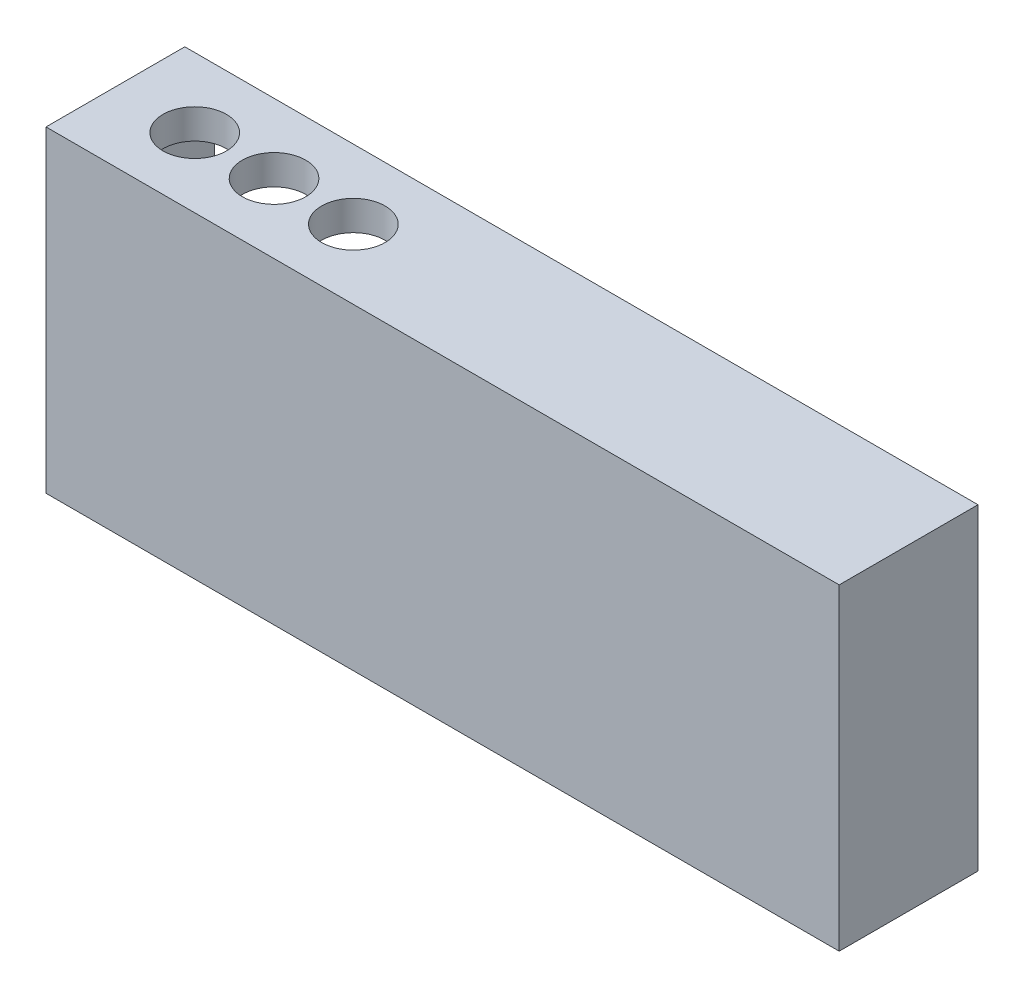
from build123d import *

# Parameters (mm, degrees)
CROQUIS1_W              = 200
CROQUIS1_H              = 80
SALIENTE_EXTRUIR1_DEPTH = 35
CROQUIS2_W              = 185
CROQUIS2_H              = 65
CORTAR_EXTRUIR1_DEPTH   = 27.5
CROQUIS3_R              = 8
CORTAR_EXTRUIR2_DEPTH   = 7.5
CROQUIS4_R              = 5.4
CORTAR_EXTRUIR3_DEPTH   = 7.5
CROQUIS5_R              = 2.50919292
CORTAR_EXTRUIR4_DEPTH   = 2


with BuildPart() as part:
    # Croquis1 → Saliente-Extruir1 (new body)
    with BuildSketch(Plane.XY):
        Rectangle(CROQUIS1_W, CROQUIS1_H)
    extrude(amount=SALIENTE_EXTRUIR1_DEPTH)

    # Croquis2 → Cortar-Extruir1 (cut)
    with BuildSketch(Plane(origin=(0, 0, 0), x_dir=(-1, 0, 0), z_dir=(0, 0, -1))):
        Rectangle(CROQUIS2_W, CROQUIS2_H)
    extrude(amount=-CORTAR_EXTRUIR1_DEPTH, mode=Mode.SUBTRACT)

    # Croquis3 → Cortar-Extruir2 (cut)
    with BuildSketch(Plane(origin=(0, 40, 0), x_dir=(1, 0, 0), z_dir=(0, 1, 0))):
        with Locations((-80, -17.5)):
            Circle(CROQUIS3_R)
        with Locations((-60, -17.5)):
            Circle(CROQUIS3_R)
        with Locations((-40, -17.5)):
            Circle(CROQUIS3_R)
    extrude(amount=-CORTAR_EXTRUIR2_DEPTH, mode=Mode.SUBTRACT)

    # Croquis4 → Cortar-Extruir3 (cut)
    with BuildSketch(Plane.XZ.offset(40)):
        with Locations((80, 17.5)):
            Circle(CROQUIS4_R)
    extrude(amount=-CORTAR_EXTRUIR3_DEPTH, mode=Mode.SUBTRACT)

    # Croquis5 → Cortar-Extruir4 (cut)
    with BuildSketch(Plane(origin=(0, 0, 0), x_dir=(-1, 0, 0), z_dir=(0, 0, -1))):
        with Locations((96.25, -36.25)):
            Circle(CROQUIS5_R)
        with Locations((-96.25, -36.25)):
            Circle(CROQUIS5_R)
        with Locations((-96.25, 36.25)):
            Circle(CROQUIS5_R)
        with Locations((96.25, 36.25)):
            Circle(CROQUIS5_R)
    extrude(amount=-CORTAR_EXTRUIR4_DEPTH, mode=Mode.SUBTRACT)


solid = part.part
